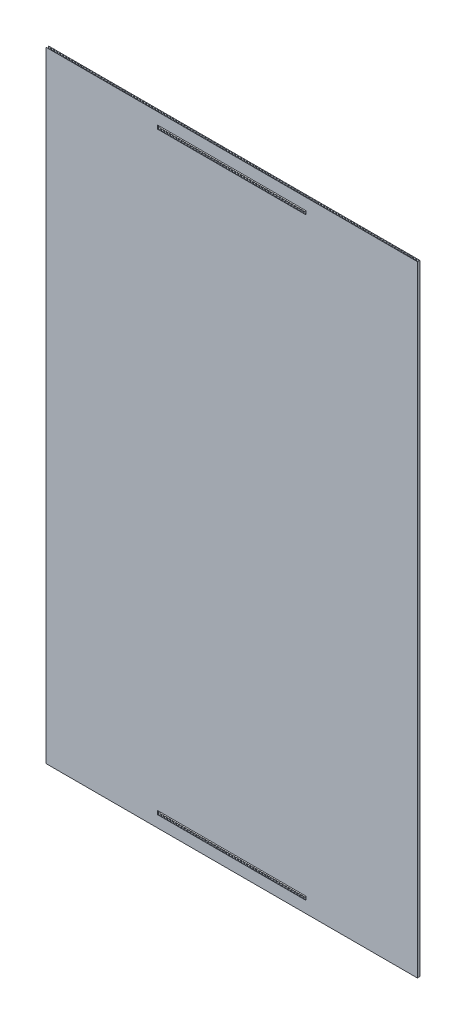
from build123d import *

# Parameters (mm, degrees)
BOSS_EXTRUDE1_DEPTH = 2090
LPATTERN1_COUNT     = 125
LPATTERN1_PITCH     = 10
SKETCH2_W           = 500.2
SKETCH2_H           = 12.1
CUT_EXTRUDE1_DEPTH  = 2433.732825445
LPATTERN2_COUNT     = 2
LPATTERN2_PITCH     = 2000


with BuildPart() as part:
    # Sketch1 → Boss-Extrude1 (new body)
    with BuildSketch(Plane(origin=(0, 0, 0), x_dir=(1, 0, 0), z_dir=(0, 1, 0))):
        Polygon((5, -4), (-5.3, -4), (-5.3, -3.7), (4.7, -3.7), (4.7, 3.7), (-5.3, 3.7), (-5.3, 4), (5, 4), align=None)
    boss_extrude1 = extrude(amount=BOSS_EXTRUDE1_DEPTH)

    # LPattern1: Boss-Extrude1 ×125
    with Locations(*[(i * LPATTERN1_PITCH, 0, 0) for i in range(1, LPATTERN1_COUNT)]):
        add(boss_extrude1)

    # Sketch2 → Cut-Extrude1 (cut, through all)
    with BuildSketch(Plane.XY.offset(4)):
        with Locations((619.85, 44.95)):
            Rectangle(SKETCH2_W, SKETCH2_H)
    cut_extrude1 = extrude(amount=-CUT_EXTRUDE1_DEPTH, mode=Mode.SUBTRACT)

    # LPattern2: Cut-Extrude1 ×2
    with Locations(*[(0, i * LPATTERN2_PITCH, 0) for i in range(1, LPATTERN2_COUNT)]):
        add(cut_extrude1, mode=Mode.SUBTRACT)


solid = part.part
